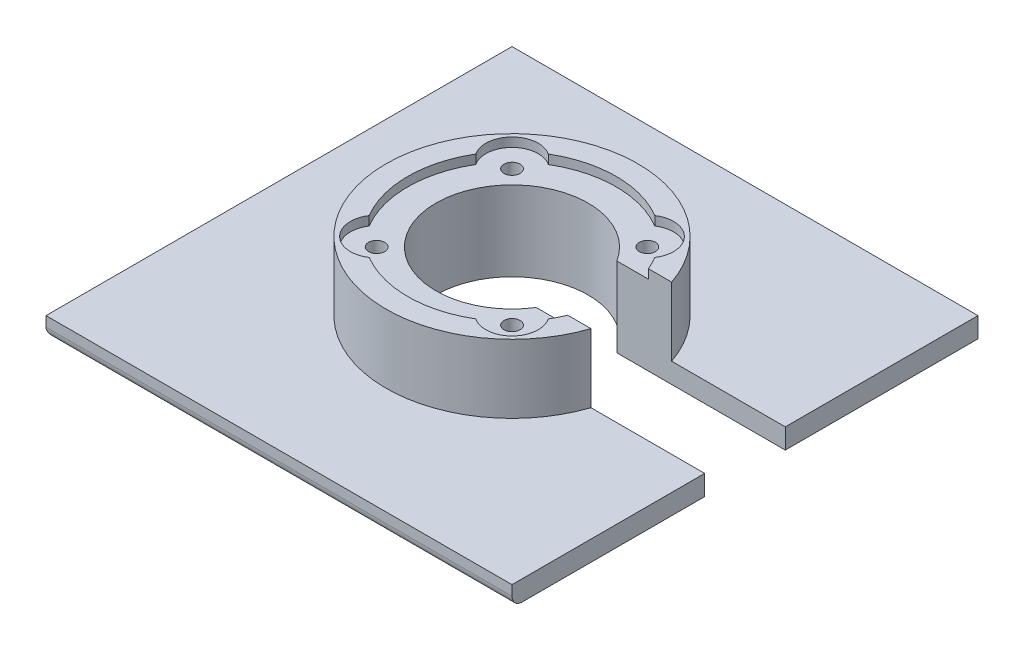
from build123d import *

# Parameters (mm, degrees)
SKETCH3_R                   = 12.5
SKETCH3_R_2                 = 7.55
BOSS_EXTRUDE2_DEPTH         = 8.8
SKETCH4_W                   = 6.878404869
SKETCH4_H                   = 8
CUT_EXTRUDE2_DEPTH          = 8.8
SKETCH8_R                   = 10.34
CUT_EXTRUDE5_DEPTH          = 0.9
TAP_DRILL_FOR_M2X0_4_TAP1_D = 1.6
CUT_EXTRUDE6_DEPTH          = 0.9
BOSS_EXTRUDE4_DEPTH         = 2
FILLET2_R                   = 1


with BuildPart() as part:
    # Sketch3 → Boss-Extrude2 (new body)
    with BuildSketch(Plane(origin=(0, 0, 0), x_dir=(1, 0, 0), z_dir=(0, 1, 0))):
        Circle(SKETCH3_R)
        Circle(SKETCH3_R_2, mode=Mode.SUBTRACT)
    extrude(amount=BOSS_EXTRUDE2_DEPTH)

    # Sketch4 → Cut-Extrude2 (cut)
    with BuildSketch(Plane(origin=(0, 8.8, 0), x_dir=(1, 0, 0), z_dir=(0, 1, 0))):
        with Locations((9.842521887, 0)):
            Rectangle(SKETCH4_W, SKETCH4_H)
    extrude(amount=-CUT_EXTRUDE2_DEPTH, mode=Mode.SUBTRACT)

    # Sketch8 → Cut-Extrude5 (cut)
    with BuildSketch(Plane(origin=(0, 8.8, 0), x_dir=(1, 0, 0), z_dir=(0, 1, 0))):
        Circle(SKETCH8_R)
    extrude(amount=-CUT_EXTRUDE5_DEPTH, mode=Mode.SUBTRACT)

    # Tap Drill for M2x0.4 Tap1 (through all)
    with Locations(Plane(origin=(6.72, 8.8, 6.715027923), x_dir=(0, 0, 1), z_dir=(0, 1, 0))):
        with Locations((0, 0), (0.004972077, -13.435027923), (-13.435027923, -13.435027923), (-13.430055846, 0)):
            Hole(TAP_DRILL_FOR_M2X0_4_TAP1_D / 2)

    # Sketch11 → Cut-Extrude6 (cut)
    with BuildSketch(Plane(origin=(0, 8.8, 0), x_dir=(1, 0, 0), z_dir=(0, 1, 0))):
        with BuildLine():
            Line((8.889256072, 5.281735177), (5.288313257, 8.885344275))
            ThreePointArc((5.288313257, 8.885344275), (8.559157895, 8.552825038), (8.889256072, 5.281735177))
        make_face()
        with BuildLine():
            Line((8.889256072, -5.281735177), (5.288313257, -8.885344275))
            ThreePointArc((5.288313257, -8.885344275), (8.559157895, -8.552825038), (8.889256072, -5.281735177))
        make_face()
        with BuildLine():
            Line((-5.281735177, -8.889256072), (-8.885344275, -5.288313257))
            ThreePointArc((-8.885344275, -5.288313257), (-8.552825038, -8.559157895), (-5.281735177, -8.889256072))
        make_face()
        with BuildLine():
            Line((-5.281735177, 8.889256072), (-8.885344275, 5.288313257))
            ThreePointArc((-8.885344275, 5.288313257), (-8.552825038, 8.559157895), (-5.281735177, 8.889256072))
        make_face()
    extrude(amount=-CUT_EXTRUDE6_DEPTH, mode=Mode.SUBTRACT)

    # Sketch12 → Boss-Extrude4 (add)
    with BuildSketch(Plane.XZ):
        with BuildLine():
            Line((23.125, -23.125), (-23.125, -23.125))
            Line((-23.125, -23.125), (-23.125, 23.125))
            Line((-23.125, 23.125), (23.125, 23.125))
            Line((23.125, 23.125), (23.125, 4))
            Line((23.125, 4), (6.403319452, 4))
            ThreePointArc((6.403319452, 4), (-7.55, 0), (6.403319452, -4))
            Line((6.403319452, -4), (23.125, -4))
            Line((23.125, -4), (23.125, -23.125))
        make_face()
    extrude(amount=-BOSS_EXTRUDE4_DEPTH)

    # Fillet2
    fillet2_edges = [part.edges().sort_by_distance(p)[0] for p in [
        (-23.125, 0, 0),
        (0, 0, 23.125),
    ]]
    fillet(fillet2_edges, radius=FILLET2_R)


solid = part.part
